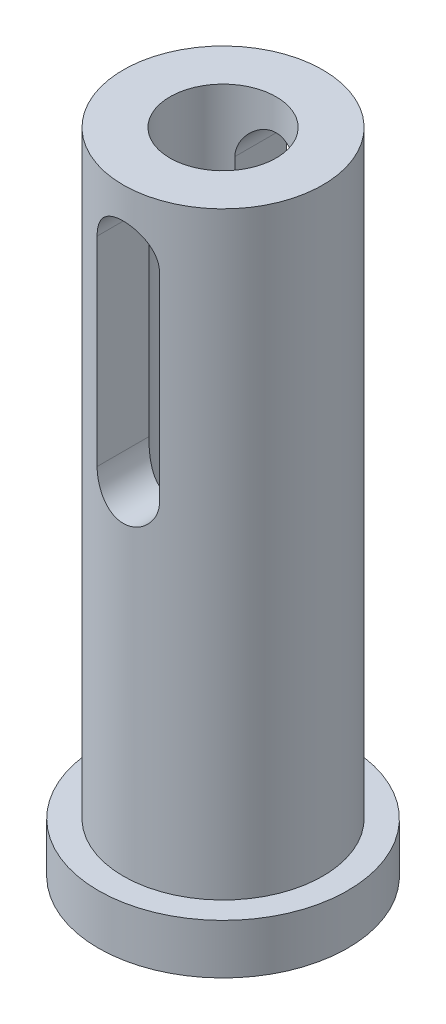
from build123d import *

# Parameters (mm, degrees)
SKETCH1_R                 = 3.175
BOSS_EXTRUDE1_DEPTH       = 1.27
SKETCH2_R                 = 2.54
BOSS_EXTRUDE2_DEPTH       = 15.24
TAP_DRILL_FOR_6_32_TAP1_D = 2.7051
CUT_EXTRUDE1_DEPTH        = 18.109685853
CUT_EXTRUDE1_DEPTH_BACK   = 18.109685853


with BuildPart() as part:
    # Sketch1 → Boss-Extrude1 (new body)
    with BuildSketch(Plane(origin=(0, 0, 0), x_dir=(1, 0, 0), z_dir=(0, 1, 0))):
        Circle(SKETCH1_R)
    extrude(amount=BOSS_EXTRUDE1_DEPTH)

    # Sketch2 → Boss-Extrude2 (add)
    with BuildSketch(Plane(origin=(0, 1.27, 0), x_dir=(1, 0, 0), z_dir=(0, 1, 0))):
        Circle(SKETCH2_R)
    extrude(amount=BOSS_EXTRUDE2_DEPTH)

    # Tap Drill for #6-32 Tap1 (through all)
    with Locations(Plane(origin=(0, 16.51, 0), x_dir=(1, 0, 0), z_dir=(0, 1, 0))):
        with Locations((0, 0)):
            Hole(TAP_DRILL_FOR_6_32_TAP1_D / 2)

    # Sketch6 → Cut-Extrude1 (cut, two sides: drawn at the far end of the back side and taken through both)
    with BuildSketch(Plane.XY.offset(-CUT_EXTRUDE1_DEPTH_BACK)):
        with BuildLine():
            Line((0.79375, 14.9225), (0.79375, 9.8425))
            ThreePointArc((0.79375, 9.8425), (0, 9.04875), (-0.79375, 9.8425))
            Line((-0.79375, 9.8425), (-0.79375, 14.9225))
            ThreePointArc((-0.79375, 14.9225), (0, 15.71625), (0.79375, 14.9225))
        make_face()
    extrude(amount=CUT_EXTRUDE1_DEPTH + CUT_EXTRUDE1_DEPTH_BACK, mode=Mode.SUBTRACT)


solid = part.part
